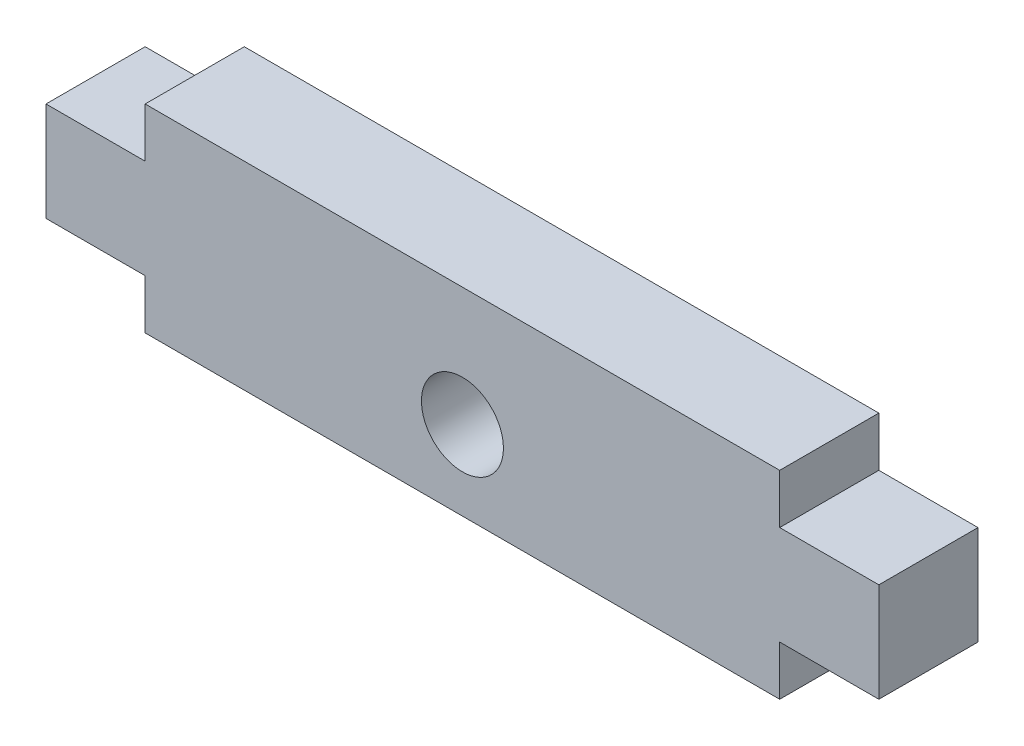
from build123d import *

# Parameters (mm, degrees)
BOSS_EXTRUDE1_DEPTH = 5
SKETCH2_R           = 2.0675
CUT_EXTRUDE1_DEPTH  = 44.462627624


with BuildPart() as part:
    # Sketch1 → Boss-Extrude1 (new body)
    with BuildSketch(Plane.XY):
        Polygon((0, 2.5), (0, 7.5), (5, 7.5), (5, 10), (37, 10), (37, 7.5), (42, 7.5), (42, 2.5), (37, 2.5), (37, 0), (5, 0), (5, 2.5), align=None)
    extrude(amount=BOSS_EXTRUDE1_DEPTH)

    # Sketch2 → Cut-Extrude1 (cut, through all)
    with BuildSketch(Plane.XY.offset(5)):
        with Locations((21, 4)):
            Circle(SKETCH2_R)
    extrude(amount=-CUT_EXTRUDE1_DEPTH, mode=Mode.SUBTRACT)


solid = part.part
